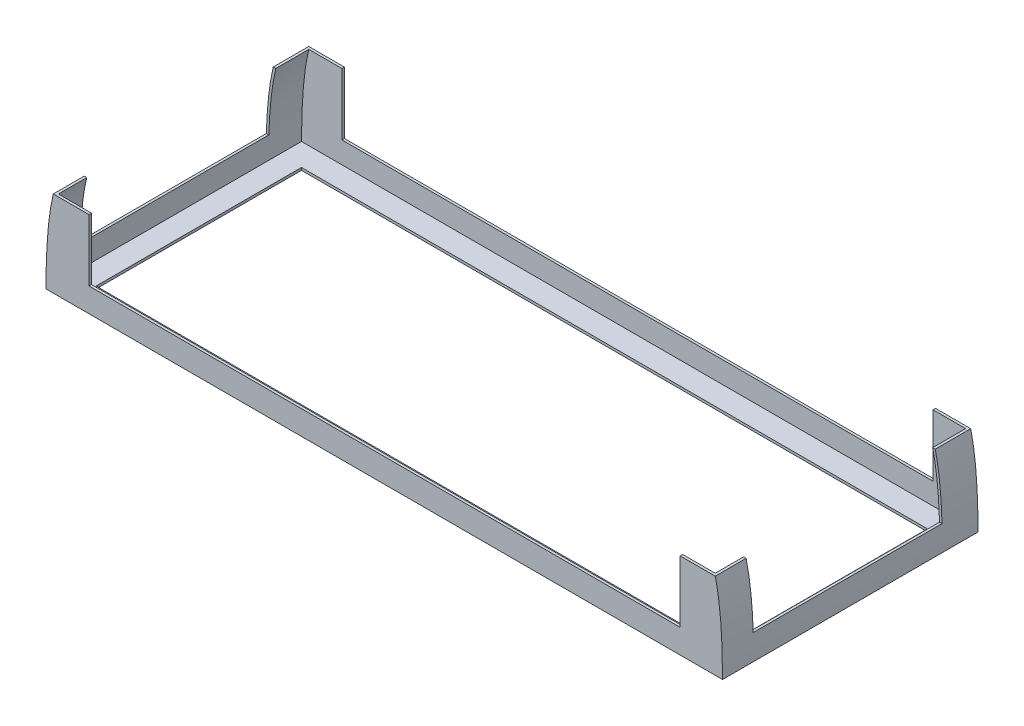
from build123d import *

# Parameters (mm, degrees)
EXTRUDE_THIN2_START    = -127
EXTRUDE_THIN2_DEPTH    = 254
SPLIT1_SURFACE_1_BACK  = 741.713
SPLIT1_SURFACE_1_DEPTH = 1483.426
BOSS_EXTRUDE2_DEPTH    = 2.54
BOSS_EXTRUDE3_DEPTH    = 2.54
SPLIT2_SURFACE_2_BACK  = 743.47
SPLIT2_SURFACE_2_DEPTH = 1486.94
SPLIT3_SURFACE_3_BACK  = 743.47
SPLIT3_SURFACE_3_DEPTH = 1486.94


# Read off the part's stored shape, not the designer's step: Extrude-Thin2
with BuildPart() as part:
    # Extrude-Thin2 outline → Extrude-Thin2 (new body)
    with BuildSketch(Plane.XY.offset(EXTRUDE_THIN2_START)):
        with BuildLine():
            Line((-325.542449195, 166.687822519), (-325.542449195, 166.669160537))
            Line((-325.542449195, 166.669160537), (-325.579794085, 166.687822519))
            add(Edge.make_bspline(
                [(-343.046678298, 50.863822519), (-342.854742326, 95.850869045), (-340.503085509, 136.824505781), (-325.579794085, 166.687822519)],
                knots=[0.396009693, 0.396009693, 0.396009693, 0.396009693, 0.524743478, 0.524743478, 0.524743478, 0.524743478], degree=3))
            Line((-343.046678298, 50.863822519), (343.046678298, 50.863822519))
            add(Edge.make_bspline(
                [(325.579794084, 166.687822519), (340.503085509, 136.824505781), (342.854742326, 95.850869045), (343.046678298, 50.863822519)],
                knots=[0.396009693, 0.396009693, 0.396009693, 0.396009693, 0.524743478, 0.524743478, 0.524743478, 0.524743478], degree=3))
            Line((325.579794084, 166.687822519), (323.307694442, 165.552409283))
            add(Edge.make_bspline(
                [(323.307694442, 165.552409283), (326.877593275, 158.408608594), (329.727019011, 150.576977672), (334.257221566, 133.733582984), (335.93764666, 124.722865717), (339.652297398, 96.250136339), (340.357498858, 75.350575466), (340.493401884, 53.403822519)],
                knots=[0, 0, 0, 0, 0.25, 0.25, 0.5, 0.5, 1, 1, 1, 1], degree=3))
            Line((340.493401884, 53.403822519), (-340.493401884, 53.403822519))
            add(Edge.make_bspline(
                [(-340.493401884, 53.403822519), (-340.357498858, 75.350575466), (-339.652297398, 96.250136339), (-335.937646661, 124.722865717), (-334.257221567, 133.733582984), (-329.727019012, 150.576977672), (-326.877593276, 158.408608594), (-323.307694443, 165.552409283)],
                knots=[0, 0, 0, 0, 0.5, 0.5, 0.75, 0.75, 1, 1, 1, 1], degree=3))
            Line((-323.307694443, 165.552409283), (-325.502746425, 166.649320276))
            Line((-325.502746425, 166.649320276), (-325.502746425, 166.687822519))
            Line((-325.502746425, 166.687822519), (-325.542449195, 166.687822519))
        make_face()
    extrude(amount=EXTRUDE_THIN2_DEPTH)

    # Split1: cut with a surface, the side behind it stays
    # Split1 surface: a surface, the sketch's curves swept straight by 1483.426 mm
    with BuildLine(Plane(origin=(0, 0, 0), x_dir=(0, 0, -1), z_dir=(1, 0, 0)).offset(-SPLIT1_SURFACE_1_BACK), mode=Mode.PRIVATE) as split1_surface_1_path:
        Line((-98.324088945, 166.687822519), (-97.98299712, 76.193733858))
        Line((-97.98299712, 76.193733858), (93.487324748, 76.104761498))
        Line((93.487324748, 76.104761498), (93.541066072, 166.687822519))
        Line((93.541066072, 166.687822519), (-98.324088945, 166.687822519))
    split1_surface_1 = Shell.extrude(split1_surface_1_path.wire(), (1 * SPLIT1_SURFACE_1_DEPTH, 0 * SPLIT1_SURFACE_1_DEPTH, 0 * SPLIT1_SURFACE_1_DEPTH))
    split(bisect_by=split1_surface_1, keep=Keep.BOTTOM)

    # Sketch6 → Boss-Extrude2 (add)
    with BuildSketch(Plane.XY.offset(129.54)):
        with BuildLine():
            Line((343.046678298, 50.863822519), (-343.046678298, 50.863822519))
            add(Edge.make_bspline(
                [(-325.579794085, 166.687822519), (-340.503085509, 136.824505781), (-342.854742326, 95.850869045), (-343.046678298, 50.863822519)],
                knots=[0.396009693, 0.396009693, 0.396009693, 0.396009693, 0.524743478, 0.524743478, 0.524743478, 0.524743478], degree=3))
            Line((-325.579794085, 166.687822519), (-325.542449195, 166.687822519))
            Line((-325.542449195, 166.687822519), (-299.506767133, 166.687822519))
            Line((-299.506767133, 166.687822519), (-299.506767133, 75.23611572))
            Line((-299.506767133, 75.23611572), (300.062358087, 75.23611572))
            Line((300.062358087, 75.23611572), (300.062358087, 166.687822519))
            Line((300.062358087, 166.687822519), (325.579794084, 166.687822519))
            add(Edge.make_bspline(
                [(325.579794084, 166.687822519), (340.503085509, 136.824505781), (342.854742326, 95.850869045), (343.046678298, 50.863822519)],
                knots=[0.396009693, 0.396009693, 0.396009693, 0.396009693, 0.524743478, 0.524743478, 0.524743478, 0.524743478], degree=3))
        make_face()
    extrude(amount=-BOSS_EXTRUDE2_DEPTH)

    # Sketch7 → Boss-Extrude3 (add)
    with BuildSketch(Plane(origin=(0, 0, -129.54), x_dir=(-1, 0, 0), z_dir=(0, 0, -1))):
        with BuildLine():
            Line((0, 50.863822519), (0, 75.23611572))
            Line((0, 75.23611572), (-300.062358087, 75.23611572))
            Line((-300.062358087, 75.23611572), (-300.062358087, 166.687822519))
            Line((-300.062358087, 166.687822519), (-325.502746425, 166.687822519))
            Line((-325.502746425, 166.687822519), (-325.542449195, 166.687822519))
            Line((-325.542449195, 166.687822519), (-325.579794085, 166.687822519))
            add(Edge.make_bspline(
                [(-325.579794085, 166.687822519), (-340.503085509, 136.824505781), (-342.854742326, 95.850869045), (-343.046678298, 50.863822519)],
                knots=[0.396009693, 0.396009693, 0.396009693, 0.396009693, 0.524743478, 0.524743478, 0.524743478, 0.524743478], degree=3))
            Line((-343.046678298, 50.863822519), (0, 50.863822519))
        make_face()
        with BuildLine():
            Line((299.506767133, 75.23611572), (0, 75.23611572))
            Line((0, 75.23611572), (0, 50.863822519))
            Line((0, 50.863822519), (343.046678298, 50.863822519))
            add(Edge.make_bspline(
                [(325.579794084, 166.687822519), (340.503085509, 136.824505781), (342.854742326, 95.850869045), (343.046678298, 50.863822519)],
                knots=[0.396009693, 0.396009693, 0.396009693, 0.396009693, 0.524743478, 0.524743478, 0.524743478, 0.524743478], degree=3))
            Line((325.579794084, 166.687822519), (299.506767133, 166.687822519))
            Line((299.506767133, 166.687822519), (299.506767133, 75.23611572))
        make_face()
    extrude(amount=-BOSS_EXTRUDE3_DEPTH)

    # Split2: cut with a surface, the side it looks to stays
    # Split2 surface: a surface, the sketch's curves swept straight by 1486.94 mm
    with BuildLine(Plane(origin=(0, 0, 0), x_dir=(1, 0, 0), z_dir=(0, 1, 0)).offset(-SPLIT2_SURFACE_2_BACK), mode=Mode.PRIVATE) as split2_surface_2_path:
        Line((-317.646678298, 104.14), (317.080123639, 104.14))
        Line((317.080123639, 104.14), (317.080123639, -104.14))
        Line((317.080123639, -104.14), (-317.646678298, -104.14))
        Line((-317.646678298, -104.14), (-317.646678298, 104.14))
    split2_surface_2 = Shell.extrude(split2_surface_2_path.wire(), (0 * SPLIT2_SURFACE_2_DEPTH, 1 * SPLIT2_SURFACE_2_DEPTH, 0 * SPLIT2_SURFACE_2_DEPTH))
    split(bisect_by=split2_surface_2, keep=Keep.TOP)

    # Split3: cut with a surface, the side behind it stays
    # Split3 surface: a surface, the sketch's curves swept straight by 1486.94 mm
    with BuildLine(Plane(origin=(0, 0, 0), x_dir=(0, 0, -1), z_dir=(1, 0, 0)).offset(-SPLIT3_SURFACE_3_BACK), mode=Mode.PRIVATE) as split3_surface_3_path:
        Line((-165.841686169, 137.985822519), (168.310027545, 137.985822519))
    split3_surface_3 = Shell.extrude(split3_surface_3_path.wire(), (1 * SPLIT3_SURFACE_3_DEPTH, 0 * SPLIT3_SURFACE_3_DEPTH, 0 * SPLIT3_SURFACE_3_DEPTH))
    split(bisect_by=split3_surface_3, keep=Keep.BOTTOM)


solid = part.part
